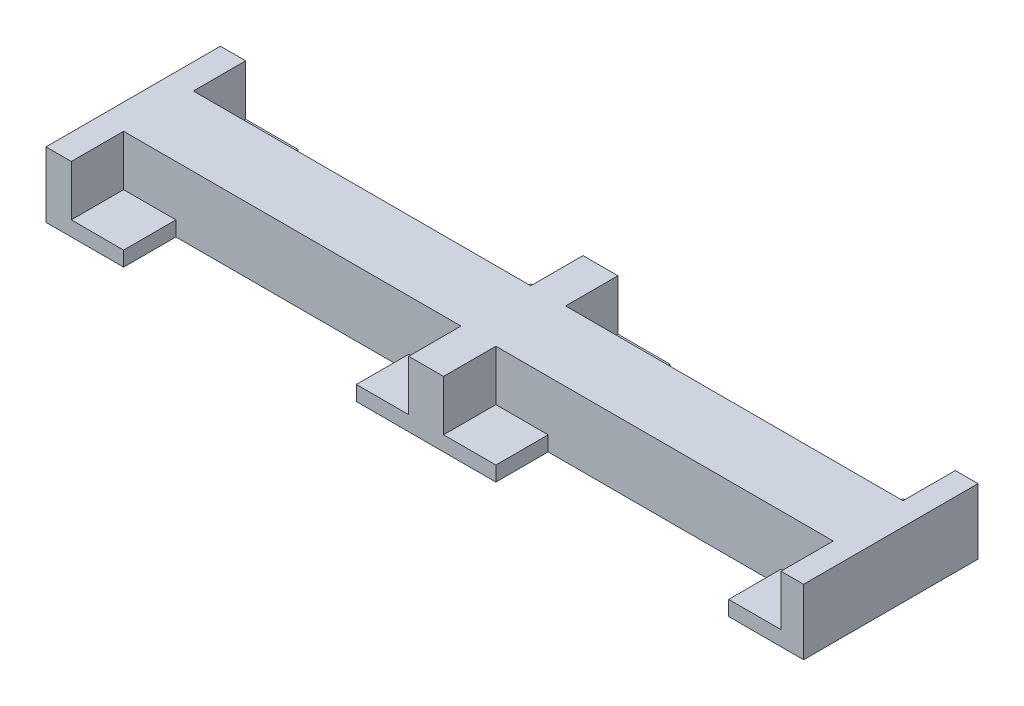
from build123d import *

# Parameters (mm, degrees)
SKETCH2_W            = 434.5
SKETCH2_H            = 100
BOSS_EXTRUDE1_DEPTH  = 37.5
CUT_EXTRUDE3_DEPTH   = 30
LPATTERN1_COUNT      = 2
LPATTERN1_PITCH      = 213.5
MIRROR1_COPY_1_DEPTH = 30


with BuildPart() as part:
    # Sketch2 → Boss-Extrude1 (new body)
    with BuildSketch(Plane(origin=(0, 0, 0), x_dir=(1, 0, 0), z_dir=(0, 1, 0))):
        with Locations((-32.75, 100)):
            Rectangle(SKETCH2_W, SKETCH2_H)
    extrude(amount=BOSS_EXTRUDE1_DEPTH)

    # Sketch5 → Cut-Extrude3 (cut)
    with BuildSketch(Plane(origin=(0, 0, -150), x_dir=(-1, 0, 0), z_dir=(0, 0, -1))):
        Polygon((42, 66.5), (72, 66.5), (72, 75), (205.5, 75), (205.5, 66.5), (235.5, 66.5), (235.5, 8.5), (205.5, 8.5), (205.5, 0), (72, 0), (72, 8.5), (42, 8.5), align=None)
    cut_extrude3 = extrude(amount=-CUT_EXTRUDE3_DEPTH, mode=Mode.SUBTRACT)

    # LPattern1: Cut-Extrude3 ×2
    with Locations(*[(i * LPATTERN1_PITCH, 0, 0) for i in range(1, LPATTERN1_COUNT)]):
        add(cut_extrude3, mode=Mode.SUBTRACT)

    # Mirror1: Cut-Extrude3 across plane
    add(cut_extrude3.mirror(Plane.XY.offset(-100)), mode=Mode.SUBTRACT)

    # Mirror1 copy 1 sketch → Mirror1 copy 1 (cut)
    with BuildSketch(Plane(origin=(213.5, 0, -50), x_dir=(-1, 0, 0), z_dir=(0, 0, 1))):
        Polygon((42, -66.5), (72, -66.5), (72, -75), (205.5, -75), (205.5, -66.5), (235.5, -66.5), (235.5, -8.5), (205.5, -8.5), (205.5, 0), (72, 0), (72, -8.5), (42, -8.5), align=None)
    extrude(amount=-MIRROR1_COPY_1_DEPTH, mode=Mode.SUBTRACT)


solid = part.part
